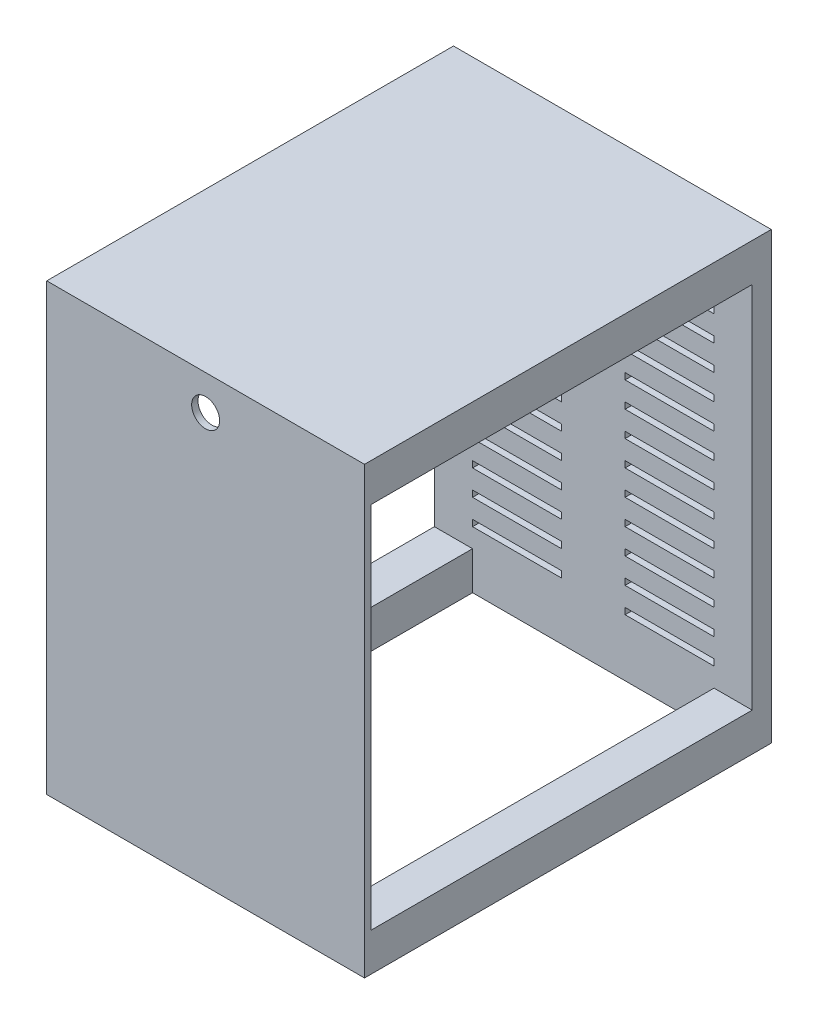
from build123d import *

# Parameters (mm, degrees)
CROQUIS1_W              = 250
CROQUIS1_H              = 350
SALIENTE_EXTRUIR2_DEPTH = 15
CROQUIS2_W              = 30
CROQUIS2_H              = 30
SALIENTE_EXTRUIR3_DEPTH = 300
CROQUIS3_W              = 250
CROQUIS3_H              = 350
SALIENTE_EXTRUIR4_DEPTH = 5
CROQUIS7_W              = 70
CROQUIS7_H              = 5
CORTAR_EXTRUIR1_DEPTH   = 20
CROQUIS9_W              = 250
CROQUIS9_H              = 320
SALIENTE_EXTRUIR6_DEPTH = 5
CROQUIS11_R             = 11
CORTAR_EXTRUIR3_DEPTH   = 10


with BuildPart() as part:
    # Croquis1 → Saliente-Extruir2 (new body)
    with BuildSketch(Plane.XY):
        Rectangle(CROQUIS1_W, CROQUIS1_H)
    extrude(amount=SALIENTE_EXTRUIR2_DEPTH)

    # Croquis2 → Saliente-Extruir3 (add)
    with BuildSketch(Plane.XY.offset(15)):
        with Locations((-110, 160)):
            Rectangle(CROQUIS2_W, CROQUIS2_H)
        with Locations((110, 160)):
            Rectangle(CROQUIS2_W, CROQUIS2_H)
        with Locations((-110, -160)):
            Rectangle(CROQUIS2_W, CROQUIS2_H)
        with Locations((110, -160)):
            Rectangle(CROQUIS2_W, CROQUIS2_H)
    extrude(amount=SALIENTE_EXTRUIR3_DEPTH)

    # Croquis3 → Saliente-Extruir4 (add)
    with BuildSketch(Plane.XY.offset(315)):
        Rectangle(CROQUIS3_W, CROQUIS3_H)
    extrude(amount=SALIENTE_EXTRUIR4_DEPTH)

    # Croquis7 → Cortar-Extruir1 (cut)
    with BuildSketch(Plane(origin=(0, 0, 0), x_dir=(-1, 0, 0), z_dir=(0, 0, -1))):
        with Locations((60, 132.5)):
            Rectangle(CROQUIS7_W, CROQUIS7_H)
        with Locations((-60, 132.5)):
            Rectangle(CROQUIS7_W, CROQUIS7_H)
        with Locations((60, 112.5)):
            Rectangle(CROQUIS7_W, CROQUIS7_H)
        with Locations((60, 92.5)):
            Rectangle(CROQUIS7_W, CROQUIS7_H)
        with Locations((60, 72.5)):
            Rectangle(CROQUIS7_W, CROQUIS7_H)
        with Locations((60, 52.5)):
            Rectangle(CROQUIS7_W, CROQUIS7_H)
        with Locations((60, 32.5)):
            Rectangle(CROQUIS7_W, CROQUIS7_H)
        with Locations((60, 12.5)):
            Rectangle(CROQUIS7_W, CROQUIS7_H)
        with Locations((60, -7.5)):
            Rectangle(CROQUIS7_W, CROQUIS7_H)
        with Locations((60, -27.5)):
            Rectangle(CROQUIS7_W, CROQUIS7_H)
        with Locations((60, -47.5)):
            Rectangle(CROQUIS7_W, CROQUIS7_H)
        with Locations((-60, 112.5)):
            Rectangle(CROQUIS7_W, CROQUIS7_H)
        with Locations((-60, 92.5)):
            Rectangle(CROQUIS7_W, CROQUIS7_H)
        with Locations((-60, 72.5)):
            Rectangle(CROQUIS7_W, CROQUIS7_H)
        with Locations((-60, 52.5)):
            Rectangle(CROQUIS7_W, CROQUIS7_H)
        with Locations((-60, 32.5)):
            Rectangle(CROQUIS7_W, CROQUIS7_H)
        with Locations((-60, 12.5)):
            Rectangle(CROQUIS7_W, CROQUIS7_H)
        with Locations((-60, -7.5)):
            Rectangle(CROQUIS7_W, CROQUIS7_H)
        with Locations((-60, -27.5)):
            Rectangle(CROQUIS7_W, CROQUIS7_H)
        with Locations((-60, -47.5)):
            Rectangle(CROQUIS7_W, CROQUIS7_H)
        with Locations((-60, -67.5)):
            Rectangle(CROQUIS7_W, CROQUIS7_H)
        with Locations((60, -67.5)):
            Rectangle(CROQUIS7_W, CROQUIS7_H)
        with Locations((-60, -87.5)):
            Rectangle(CROQUIS7_W, CROQUIS7_H)
        with Locations((60, -87.5)):
            Rectangle(CROQUIS7_W, CROQUIS7_H)
        with Locations((-60, -107.5)):
            Rectangle(CROQUIS7_W, CROQUIS7_H)
        with Locations((60, -107.5)):
            Rectangle(CROQUIS7_W, CROQUIS7_H)
        with Locations((-60, -127.5)):
            Rectangle(CROQUIS7_W, CROQUIS7_H)
        with Locations((60, -127.5)):
            Rectangle(CROQUIS7_W, CROQUIS7_H)
    extrude(amount=-CORTAR_EXTRUIR1_DEPTH, mode=Mode.SUBTRACT)

    # Croquis9 → Saliente-Extruir6 (add)
    with BuildSketch(Plane(origin=(0, 175, 0), x_dir=(1, 0, 0), z_dir=(0, 1, 0))):
        with Locations((0, -160)):
            Rectangle(CROQUIS9_W, CROQUIS9_H)
    extrude(amount=-SALIENTE_EXTRUIR6_DEPTH)

    # Croquis11 → Cortar-Extruir3 (cut)
    with BuildSketch(Plane.XY.offset(320)):
        with Locations((0, 147.664359607)):
            Circle(CROQUIS11_R)
    extrude(amount=-CORTAR_EXTRUIR3_DEPTH, mode=Mode.SUBTRACT)


solid = part.part
